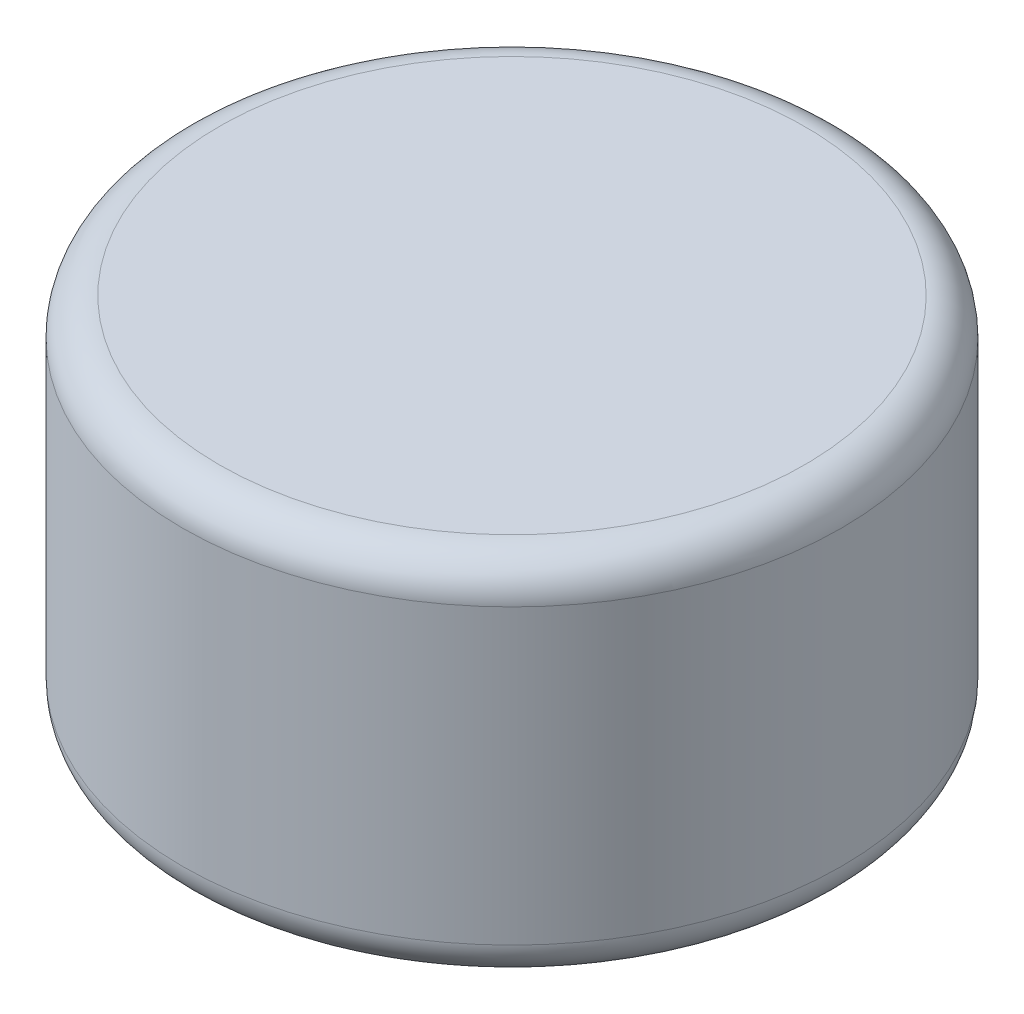
from build123d import *

# Parameters (mm, degrees)
SKETCH_1_R          = 45
EXTRUDE_1_DEPTH     = 25
FILLET_1_R          = 5
SKETCH_9_R          = 40.1
CUT_EXTRUDE_1_DEPTH = 20.05


with BuildPart() as part:
    # 草图1 → 凸台-拉伸1 (new, symmetric)
    with BuildSketch(Plane(origin=(0, 0, 0), x_dir=(1, 0, 0), z_dir=(0, 1, 0))):
        Circle(SKETCH_1_R)
    extrude(amount=EXTRUDE_1_DEPTH, both=True)

    # 圆角1
    fillet_1_edges = [part.edges().sort_by_distance(p)[0] for p in [
        (-45, -25, 0),
        (-45, 25, 0),
    ]]
    fillet(fillet_1_edges, radius=FILLET_1_R)

    # 草图9 → 切除-拉伸1 (cut, symmetric)
    with BuildSketch(Plane(origin=(0, 0, 0), x_dir=(1, 0, 0), z_dir=(0, 1, 0))):
        Circle(SKETCH_9_R)
    extrude(amount=CUT_EXTRUDE_1_DEPTH, both=True, mode=Mode.SUBTRACT)


solid = part.part
